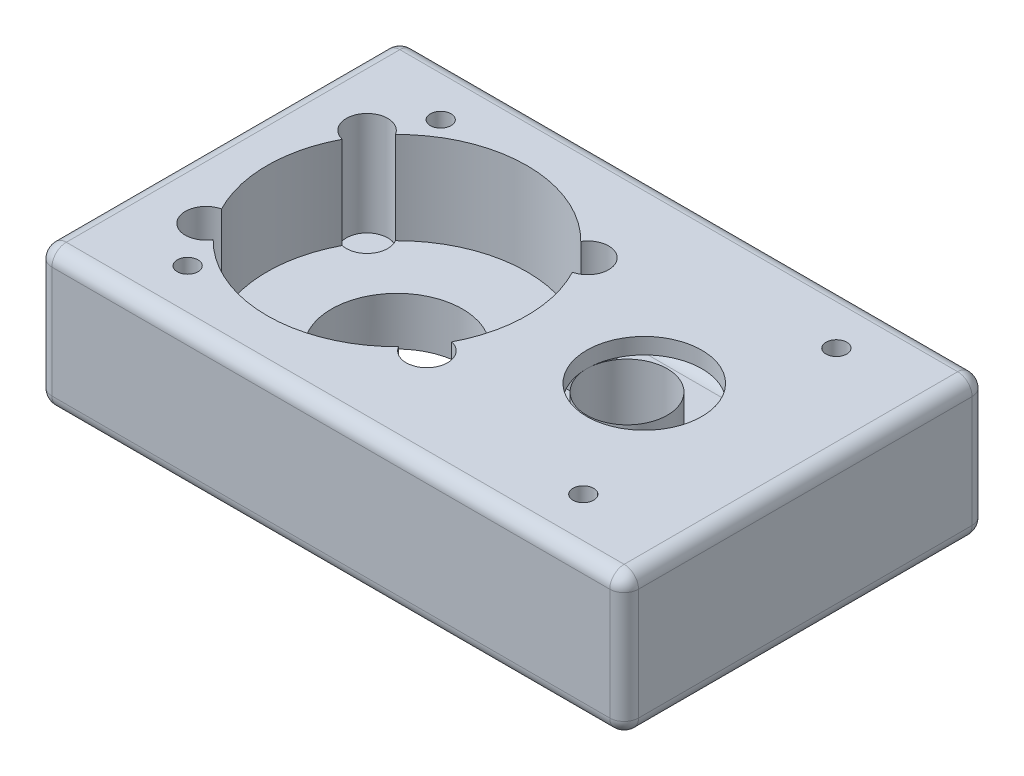
from build123d import *

# Parameters (mm, degrees)
SKETCH1_W             = 64.77
SKETCH1_H             = 40.005
BOSS_EXTRUDE1_DEPTH   = 15.494
CAVITY1_START         = 5.334
CAVITY1_OUTLINE_R     = 1.143
CAVITY1_OUTLINE_R_2   = 4.445
CAVITY1_DEPTH         = 10.16
CAVITY1_2_OUTLINE_R   = 1.143
CAVITY1_2_OUTLINE_R_2 = 7.239
CAVITY1_2_DEPTH       = 5.334
CAVITY1_START_2       = 2.286
CAVITY1_3_OUTLINE_R   = 4.445
CAVITY1_3_DEPTH       = 3.048
CAVITY1_START_3       = 13.716
CAVITY1_4_DEPTH       = 1.778
CAVITY1_5_OUTLINE_R   = 1.905
CAVITY1_5_OUTLINE_R_2 = 1.143
CAVITY1_5_DEPTH       = 3.302
CAVITY1_START_4       = 4.064
CAVITY1_6_OUTLINE_R   = 2.286
CAVITY1_6_DEPTH       = 1.27
CAVITY1_START_5       = 2.032
CAVITY1_7_DEPTH       = 0.254
SKETCH3_R             = 1.905
CUT_EXTRUDE1_DEPTH    = 6.35
FILLET1_R             = 1.5875


# Read off the part's stored shape, not the designer's step: Cavity1
with BuildPart() as part:
    # Sketch1 → Boss-Extrude1 (new body)
    with BuildSketch(Plane(origin=(0, 0, 0), x_dir=(1, 0, 0), z_dir=(0, 1, 0))):
        with Locations((32.385, 20.0025)):
            Rectangle(SKETCH1_W, SKETCH1_H)
    extrude(amount=BOSS_EXTRUDE1_DEPTH)

    # Cavity1 outline → Cavity1 (cut)
    with BuildSketch(Plane(origin=(0, 0, 0), x_dir=(1, 0, 0), z_dir=(0, 1, 0)).offset(CAVITY1_START)):
        with Locations((10.541, 6.0325)):
            Circle(CAVITY1_OUTLINE_R)
        with BuildLine():
            ThreePointArc((9.454432496, 9.938371148), (19.685, 5.6515), (29.915567504, 9.938371148))
            ThreePointArc((29.915567504, 9.938371148), (33.724105214, 9.765652448), (32.395188518, 13.338994253))
            ThreePointArc((32.395188518, 13.338994253), (34.036, 20.0025), (32.395188518, 26.666005747))
            ThreePointArc((32.395188518, 26.666005747), (33.724105214, 30.239347552), (29.915567504, 30.066628852))
            ThreePointArc((29.915567504, 30.066628852), (19.685, 34.3535), (9.454432496, 30.066628852))
            ThreePointArc((9.454432496, 30.066628852), (5.645894786, 30.239347552), (6.974811482, 26.666005747))
            ThreePointArc((6.974811482, 26.666005747), (5.334, 20.0025), (6.974811482, 13.338994253))
            ThreePointArc((6.974811482, 13.338994253), (5.645894786, 9.765652448), (9.454432496, 9.938371148))
        make_face()
        with Locations((54.229, 6.0325)):
            Circle(CAVITY1_OUTLINE_R)
        with Locations((45.085, 20.0025)):
            Circle(CAVITY1_OUTLINE_R_2)
        with Locations((10.541, 33.9725)):
            Circle(CAVITY1_OUTLINE_R)
        with Locations((54.229, 33.9725)):
            Circle(CAVITY1_OUTLINE_R)
    extrude(amount=CAVITY1_DEPTH, mode=Mode.SUBTRACT)

    # Cavity1 2 outline → Cavity1 2 (cut)
    with BuildSketch(Plane(origin=(0, 0, 0), x_dir=(1, 0, 0), z_dir=(0, 1, 0))):
        with Locations((10.541, 6.0325)):
            Circle(CAVITY1_2_OUTLINE_R)
        with Locations((54.229, 6.0325)):
            Circle(CAVITY1_2_OUTLINE_R)
        with Locations((10.541, 33.9725)):
            Circle(CAVITY1_2_OUTLINE_R)
        with Locations((54.229, 33.9725)):
            Circle(CAVITY1_2_OUTLINE_R)
        with Locations((19.685, 20.0025)):
            Circle(CAVITY1_2_OUTLINE_R_2)
    extrude(amount=CAVITY1_2_DEPTH, mode=Mode.SUBTRACT)

    # Cavity1 3 outline → Cavity1 3 (cut)
    with BuildSketch(Plane(origin=(0, 0, 0), x_dir=(1, 0, 0), z_dir=(0, 1, 0)).offset(CAVITY1_START_2)):
        with BuildLine():
            ThreePointArc((33.571815, 23.62293784), (28.575, 20.0025), (33.571815, 16.38206216))
            ThreePointArc((33.571815, 16.38206216), (34.036, 20.0025), (33.571815, 23.62293784))
        make_face()
        with Locations((45.085, 20.0025)):
            Circle(CAVITY1_3_OUTLINE_R)
    extrude(amount=CAVITY1_3_DEPTH, mode=Mode.SUBTRACT)

    # Cavity1 4 outline → Cavity1 4 (cut)
    with BuildSketch(Plane(origin=(0, 0, 0), x_dir=(1, 0, 0), z_dir=(0, 1, 0)).offset(CAVITY1_START_3)):
        with BuildLine():
            Line((44.074058668, 15.673987251), (45.983725966, 13.732738237))
            ThreePointArc((45.983725966, 13.732738237), (49.973349777, 14.396955949), (52.752669641, 17.335265738))
            Line((52.752669641, 17.335265738), (49.261068942, 18.479846661))
            ThreePointArc((49.261068942, 18.479846661), (47.1998806, 16.092857427), (44.074058668, 15.673987251))
        make_face()
        with BuildLine():
            ThreePointArc((40.766648336, 18.740599029), (42.59266679, 15.421456381), (45.983725966, 13.732738237))
            Line((45.983725966, 13.732738237), (44.074058668, 15.673987251))
            ThreePointArc((44.074058668, 15.673987251), (42.028662496, 16.774989185), (40.817941907, 18.757413564))
            Line((40.817941907, 18.757413564), (40.766648336, 18.740599029))
        make_face()
        with BuildLine():
            Line((49.261068942, 18.479846661), (52.752669641, 17.335265738))
            ThreePointArc((52.752669641, 17.335265738), (53.19142936, 18.636932759), (53.34, 20.0025))
            ThreePointArc((53.34, 20.0025), (53.19142936, 21.368067241), (52.752669641, 22.669734262))
            Line((52.752669641, 22.669734262), (49.261068942, 21.525153339))
            ThreePointArc((49.261068942, 21.525153339), (49.462250932, 20.775610132), (49.53, 20.0025))
            ThreePointArc((49.53, 20.0025), (49.462250932, 19.229389868), (49.261068942, 18.479846661))
        make_face()
        with BuildLine():
            ThreePointArc((40.704577582, 19.099192174), (40.73304351, 18.919450842), (40.766648336, 18.740599029))
            Line((40.766648336, 18.740599029), (40.817941907, 18.757413564))
            ThreePointArc((40.817941907, 18.757413564), (40.776510846, 18.909364048), (40.740488936, 19.062686925))
            Line((40.740488936, 19.062686925), (40.704577582, 19.099192174))
        make_face()
        with BuildLine():
            Line((49.261068942, 21.525153339), (52.752669641, 22.669734262))
            ThreePointArc((52.752669641, 22.669734262), (49.973349777, 25.608044051), (45.983725966, 26.272261763))
            Line((45.983725966, 26.272261763), (44.074058668, 24.33101275))
            ThreePointArc((44.074058668, 24.33101275), (47.1998806, 23.912142573), (49.261068942, 21.525153339))
        make_face()
        with BuildLine():
            Line((40.817941907, 21.247586436), (40.766648336, 21.264400971))
            ThreePointArc((40.766648336, 21.264400971), (40.73304351, 21.085549158), (40.704577582, 20.905807826))
            Line((40.704577582, 20.905807826), (40.740488936, 20.942313075))
            ThreePointArc((40.740488936, 20.942313075), (40.776510846, 21.095635952), (40.817941907, 21.247586436))
        make_face()
        with BuildLine():
            ThreePointArc((45.983725966, 26.272261763), (42.59266679, 24.583543619), (40.766648336, 21.264400971))
            Line((40.766648336, 21.264400971), (40.817941907, 21.247586436))
            ThreePointArc((40.817941907, 21.247586436), (42.028662496, 23.230010815), (44.074058668, 24.33101275))
            Line((44.074058668, 24.33101275), (45.983725966, 26.272261763))
        make_face()
        with BuildLine():
            ThreePointArc((40.64, 20.0025), (40.656164971, 19.549693393), (40.704577582, 19.099192174))
            Line((40.704577582, 19.099192174), (40.740488936, 19.062686925))
            ThreePointArc((40.740488936, 19.062686925), (40.665193631, 19.529914917), (40.64, 20.0025))
        make_face()
        with BuildLine():
            Line((40.740488936, 20.942313075), (40.704577582, 20.905807826))
            ThreePointArc((40.704577582, 20.905807826), (40.656164971, 20.455306607), (40.64, 20.0025))
            ThreePointArc((40.64, 20.0025), (40.665193631, 20.475085083), (40.740488936, 20.942313075))
        make_face()
    extrude(amount=CAVITY1_4_DEPTH, mode=Mode.SUBTRACT)

    # Cavity1 5 outline → Cavity1 5 (cut)
    # profile 1 of 4: a face of its own
    with BuildSketch(Plane(origin=(0, 0, 0), x_dir=(1, 0, 0), z_dir=(0, 1, 0))):
        with Locations((10.541, 6.0325)):
            Circle(CAVITY1_5_OUTLINE_R)
        with Locations((10.541, 6.0325)):
            Circle(CAVITY1_5_OUTLINE_R_2, mode=Mode.SUBTRACT)
    # profile 2 of 4: a face of its own
    with BuildSketch(Plane(origin=(0, 0, 0), x_dir=(1, 0, 0), z_dir=(0, 1, 0))):
        with Locations((54.229, 6.0325)):
            Circle(CAVITY1_5_OUTLINE_R)
        with Locations((54.229, 6.0325)):
            Circle(CAVITY1_5_OUTLINE_R_2, mode=Mode.SUBTRACT)
    # profile 3 of 4: a face of its own
    with BuildSketch(Plane(origin=(0, 0, 0), x_dir=(1, 0, 0), z_dir=(0, 1, 0))):
        with Locations((10.541, 33.9725)):
            Circle(CAVITY1_5_OUTLINE_R)
        with Locations((10.541, 33.9725)):
            Circle(CAVITY1_5_OUTLINE_R_2, mode=Mode.SUBTRACT)
    # profile 4 of 4: a face of its own
    with BuildSketch(Plane(origin=(0, 0, 0), x_dir=(1, 0, 0), z_dir=(0, 1, 0))):
        with Locations((54.229, 33.9725)):
            Circle(CAVITY1_5_OUTLINE_R)
        with Locations((54.229, 33.9725)):
            Circle(CAVITY1_5_OUTLINE_R_2, mode=Mode.SUBTRACT)
    extrude(amount=CAVITY1_5_DEPTH, mode=Mode.SUBTRACT)

    # Cavity1 6 outline → Cavity1 6 (cut)
    with BuildSketch(Plane(origin=(0, 0, 0), x_dir=(1, 0, 0), z_dir=(0, 1, 0)).offset(CAVITY1_START_4)):
        with Locations((7.493, 11.1125)):
            Circle(CAVITY1_6_OUTLINE_R)
        with Locations((31.877, 11.1125)):
            Circle(CAVITY1_6_OUTLINE_R)
        with Locations((7.493, 28.8925)):
            Circle(CAVITY1_6_OUTLINE_R)
        with Locations((31.877, 28.8925)):
            Circle(CAVITY1_6_OUTLINE_R)
    extrude(amount=CAVITY1_6_DEPTH, mode=Mode.SUBTRACT)

    # Cavity1 7 outline → Cavity1 7 (cut)
    with BuildSketch(Plane(origin=(0, 0, 0), x_dir=(1, 0, 0), z_dir=(0, 1, 0)).offset(CAVITY1_START_5)):
        with BuildLine():
            ThreePointArc((33.571815, 23.62293784), (28.575, 20.0025), (33.571815, 16.38206216))
            ThreePointArc((33.571815, 16.38206216), (34.036, 20.0025), (33.571815, 23.62293784))
        make_face()
    extrude(amount=CAVITY1_7_DEPTH, mode=Mode.SUBTRACT)

    # Sketch3 → Cut-Extrude1 (cut)
    with BuildSketch(Plane.XZ):
        with Locations(Location((4.7625, -35.2425, 0), (0, 0, 270))):
            Circle(SKETCH3_R)
        with Locations(Location((60.0075, -35.2425, 0), (0, 0, 270))):
            Circle(SKETCH3_R)
    cut_extrude1 = extrude(amount=-CUT_EXTRUDE1_DEPTH, mode=Mode.SUBTRACT)

    # Mirror3: Cut-Extrude1 across plane
    add(cut_extrude1.mirror(Plane(origin=(0, 0, -20.0025), x_dir=(1, 0, 0), z_dir=(0, 0, -1))), mode=Mode.SUBTRACT)

    # Fillet1
    fillet1_edges = [part.edges().sort_by_distance(p)[0] for p in [
        (64.77, 15.494, -20.0025),
        (32.385, 15.494, -40.005),
        (0, 15.494, -20.0025),
        (32.385, 0, -40.005),
        (64.77, 0, -20.0025),
        (32.385, 0, 0),
        (0, 0, -20.0025),
        (0, 7.747, -40.005),
        (64.77, 7.747, -40.005),
        (64.77, 7.747, 0),
        (0, 7.747, 0),
        (32.385, 15.494, 0),
    ]]
    fillet(fillet1_edges, radius=FILLET1_R)


solid = part.part
